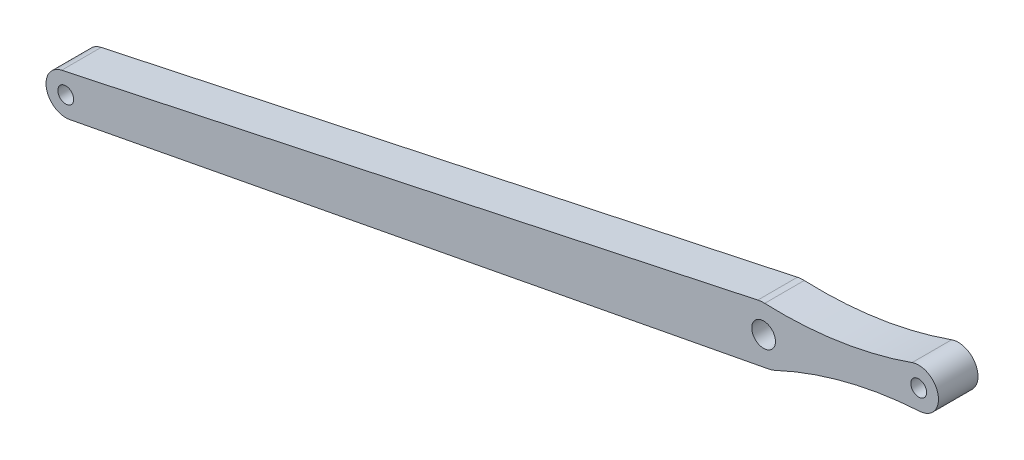
from build123d import *

# Parameters (mm, degrees)
BOSS_EXTRUDE1_DEPTH      = 5
BOSS_EXTRUDE1_DEPTH_BACK = 5
SKETCH1_R                = 3
SKETCH1_R_2              = 2


with BuildPart() as part:
    # Sketch1 → Boss-Extrude1 (new, two sides: drawn at the far end of the back side and taken through both)
    with BuildSketch(Plane.XY.offset(-BOSS_EXTRUDE1_DEPTH_BACK)):
        with BuildLine():
            Line((-235.869096848, 107.363231548), (-59.074771971, 141.123662404))
            ThreePointArc((-59.074771971, 141.123662404), (-58.228380437, 141.340811814), (-57.415636973, 141.661717653))
            ThreePointArc((-57.415636973, 141.661717653), (-39.592726055, 148.04093481), (-20.886983745, 150.947095462))
            ThreePointArc((-20.886983745, 150.947095462), (-16.282962212, 156.930655082), (-22.85215578, 160.651635579))
            ThreePointArc((-22.85215578, 160.651635579), (-41.214852935, 156.051427073), (-60.115452759, 154.994123233))
            ThreePointArc((-60.115452759, 154.994123233), (-60.989014043, 154.973551898), (-61.853206387, 154.844307603))
            Line((-61.853206387, 154.844307603), (-237.853692859, 117.163692404))
            ThreePointArc((-237.853692859, 117.163692404), (-241.707477427, 111.282128926), (-235.869096848, 107.363231548))
        make_face()
        with Locations((-60.387758667, 147.999421703)):
            Circle(SKETCH1_R, mode=Mode.SUBTRACT)
        with Locations((-236.806944487, 112.27448819)):
            Circle(SKETCH1_R_2, mode=Mode.SUBTRACT)
        with Locations((-21.183495151, 155.938295817)):
            Circle(SKETCH1_R_2, mode=Mode.SUBTRACT)
    extrude(amount=BOSS_EXTRUDE1_DEPTH + BOSS_EXTRUDE1_DEPTH_BACK)


solid = part.part
